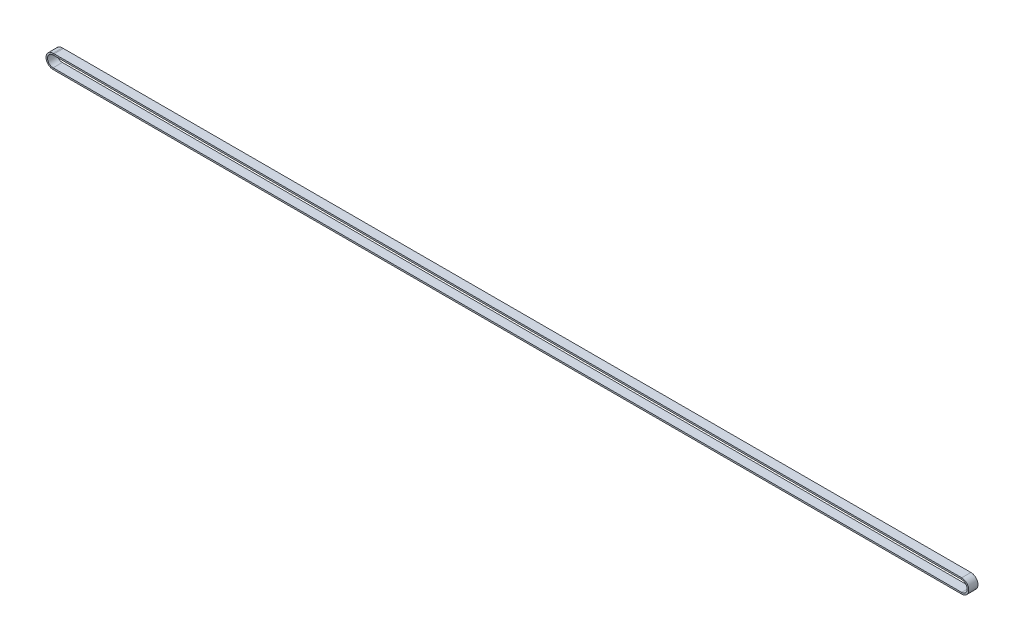
from build123d import *

# Parameters (mm, degrees)
SKETCH3_W = 9
SKETCH3_H = 1.5


with BuildPart() as part:
    # Sweep1: sweep along a path in Sketch2
    with BuildLine(Plane.XY.offset(-65.483366658)) as sweep1_path:
        Line((-1, -249.662042382), (883.520637828, -249.662042382))
        ThreePointArc((883.520637828, -249.662042382), (890.420637828, -256.562042382), (883.520637828, -263.462042382))
        Line((883.520637828, -263.462042382), (-1, -263.462042382))
        ThreePointArc((-1, -263.462042382), (-7.9, -256.562042382), (-1, -249.662042382))
    # Sketch3 → Sweep1 (sweep)
    with BuildSketch(Plane(origin=(0, 0, 0), x_dir=(0, 0, -1), z_dir=(1, 0, 0))):
        with Locations((60.983366658, -250.412042382)):
            Rectangle(SKETCH3_W, SKETCH3_H)
    sweep(path=sweep1_path.line)


solid = part.part
